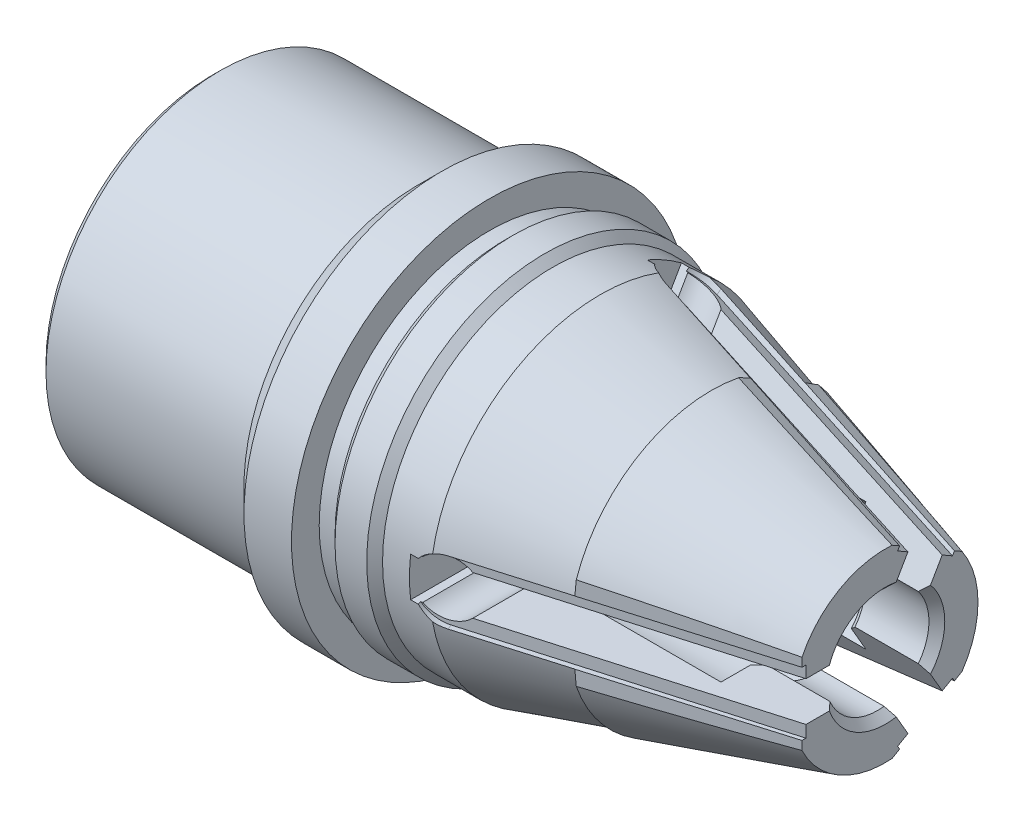
from build123d import *

# Parameters (mm, degrees)
ENL_V_MAT_EXTRU_1_DEPTH      = 93.059763198
ESQUISSE4_W                  = 8
ESQUISSE4_H                  = 8
ENL_V_MAT_EXTRU_2_DEPTH      = 99.017497017
ENL_V_MAT_EXTRU_3_DEPTH      = 93.059763198
CHANFREIN1_SIZE              = 1
CHANFREIN2_SIZE              = 1
R_P_TITION_CIRCULAIRE1_COUNT = 3


with BuildPart() as part:
    # Esquisse1 → Révolution1 (revolve)
    with BuildSketch(Plane.XY, mode=Mode.PRIVATE) as r_volution1_sk:
        Polygon((0, 0), (0, 22), (26, 22), (29, 25), (35, 25), (35, 21.5), (37, 21.5), (37, 22.5), (43, 22.5), (43, 21.5), (49, 21.5), (62.862181322, 17.525083469), (63, 18.005714317), (85, 11.697315831), (85, 0), align=None)
    revolve(r_volution1_sk.sketch.rotate(Axis((0, 0, 0), (-1, 0, 0)), 90), axis=Axis((0, 0, 0), (-1, 0, 0)))

    # Esquisse2 → Enlèvement de matière-Révolution1 (revolve, cut)
    with BuildSketch(Plane.XY, mode=Mode.PRIVATE) as enl_vement_de_mati_re_r_volution1_sk:
        Polygon((0, 0), (85, 0), (85, 6.5), (75, 6.5), (75, 11.05), (44, 11.05), (44, 13.75), (35.05, 13.75), (35.05, 14.25), (25.05, 14.25), (25.05, 13.75), (16.1, 13.75), (16.1, 17.5), (0, 17.5), align=None)
    revolve(enl_vement_de_mati_re_r_volution1_sk.sketch.rotate(Axis((0, 0, 0), (-1, 0, 0)), 90), axis=Axis((0, 0, 0), (-1, 0, 0)), mode=Mode.SUBTRACT)

    # Esquisse3 → Enlèv. mat.-Extru.1 (cut, through all)
    with BuildSketch(Plane.XY):
        with BuildLine():
            Line((46.4, 2.5), (47.450510257, 2.5))
            ThreePointArc((47.450510257, 2.5), (49.9, 3.5), (52.349489743, 2.5))
            Line((52.349489743, 2.5), (85, 2.5))
            Line((85, 2.5), (85, -2.5))
            Line((85, -2.5), (52.349489743, -2.5))
            ThreePointArc((52.349489743, -2.5), (49.9, -3.5), (47.450510257, -2.5))
            Line((47.450510257, -2.5), (46.4, -2.5))
            Line((46.4, -2.5), (46.4, 2.5))
        make_face()
    enl_v_mat_extru_1 = extrude(amount=ENL_V_MAT_EXTRU_1_DEPTH, mode=Mode.SUBTRACT)

    # Enlèvement de matière-Balayage1: sweep along a path in Esquisse5
    with BuildLine(Plane(origin=(0, 0, 0), x_dir=(1, 0, 0), z_dir=(0, 1, 0))) as enl_vement_de_mati_re_balayage1_path:
        Line((85, -10.027038008), (51, -19.834907976))
    # Esquisse4 → Enlèvement de matière-Balayage1 (sweep, cut)
    with BuildSketch(Plane(origin=(85, 0, 0), x_dir=(0, 0, -1), z_dir=(1, 0, 0))):
        with Locations((-14.027038008, 0)):
            Rectangle(ESQUISSE4_W, ESQUISSE4_H)
    enl_vement_de_mati_re_balayage1 = sweep(path=enl_vement_de_mati_re_balayage1_path.line, mode=Mode.SUBTRACT)

    # Esquisse6 → Enlèv. mat.-Extru.2 (cut, through all)
    with BuildSketch(Plane(origin=(9.2000168, 0, 31.892813855), x_dir=(0.960822254173934, 0, -0.27716528621766534), z_dir=(0.27716528621766534, 0, 0.960822254173934))):
        with BuildLine():
            Line((42.716820971, 4), (44.90890251, 4))
            Line((44.90890251, 4), (44.90890251, -4))
            Line((44.90890251, -4), (42.716820971, -4))
            ThreePointArc((42.716820971, -4), (38.716820971, 0), (42.716820971, 4))
        make_face()
    enl_v_mat_extru_2 = extrude(amount=ENL_V_MAT_EXTRU_2_DEPTH, mode=Mode.SUBTRACT)

    # Esquisse7 → Enlèv. mat.-Extru.3 (cut, symmetric)
    with BuildSketch(Plane(origin=(0, 0, 0), x_dir=(1, 0, 0), z_dir=(0, 1, 0))):
        Polygon((49, -21.178273763), (85, -10.527038008), (85, -14.527038008), (49, -25.178273763), align=None)
    enl_v_mat_extru_3 = extrude(amount=ENL_V_MAT_EXTRU_3_DEPTH, both=True, mode=Mode.SUBTRACT)

    # Chanfrein1
    chanfrein1_edges = [part.edges().sort_by_distance(p)[0] for p in [
        (44, 0, 11.05),
        (16.1, 0, 13.75),
        (0, 0, 17.5),
        (75, 0, -6.5),
        (85, 0, -6.5),
        (0, 0, 22),
    ]]
    chamfer(chanfrein1_edges, length=CHANFREIN1_SIZE)

    # Chanfrein2
    chanfrein2_edges = [part.edges().sort_by_distance(p)[0] for p in [
        (37, 0, 22.5),
        (43, 0, 22.5),
    ]]
    chamfer(chanfrein2_edges, length=CHANFREIN2_SIZE - 0.0001)  # a hair under: the kernel refuses the full size

    # Répétition circulaire1: Enlèv. mat.-Extru.1, Enlèvement de matière-Balayage1, Enlèv. mat.-Extru.2, Enlèv. mat.-Extru.3 ×3 about axis
    r_p_tition_circulaire1_axis = Axis((0, 0, 0), (1, 0, 0))
    add([enl_v_mat_extru_1.rotate(r_p_tition_circulaire1_axis, i * 360 / R_P_TITION_CIRCULAIRE1_COUNT) for i in range(1, R_P_TITION_CIRCULAIRE1_COUNT)], mode=Mode.SUBTRACT)
    add([enl_vement_de_mati_re_balayage1.rotate(r_p_tition_circulaire1_axis, i * 360 / R_P_TITION_CIRCULAIRE1_COUNT) for i in range(1, R_P_TITION_CIRCULAIRE1_COUNT)], mode=Mode.SUBTRACT)
    add([enl_v_mat_extru_2.rotate(r_p_tition_circulaire1_axis, i * 360 / R_P_TITION_CIRCULAIRE1_COUNT) for i in range(1, R_P_TITION_CIRCULAIRE1_COUNT)], mode=Mode.SUBTRACT)
    add([enl_v_mat_extru_3.rotate(r_p_tition_circulaire1_axis, i * 360 / R_P_TITION_CIRCULAIRE1_COUNT) for i in range(1, R_P_TITION_CIRCULAIRE1_COUNT)], mode=Mode.SUBTRACT)


solid = part.part
